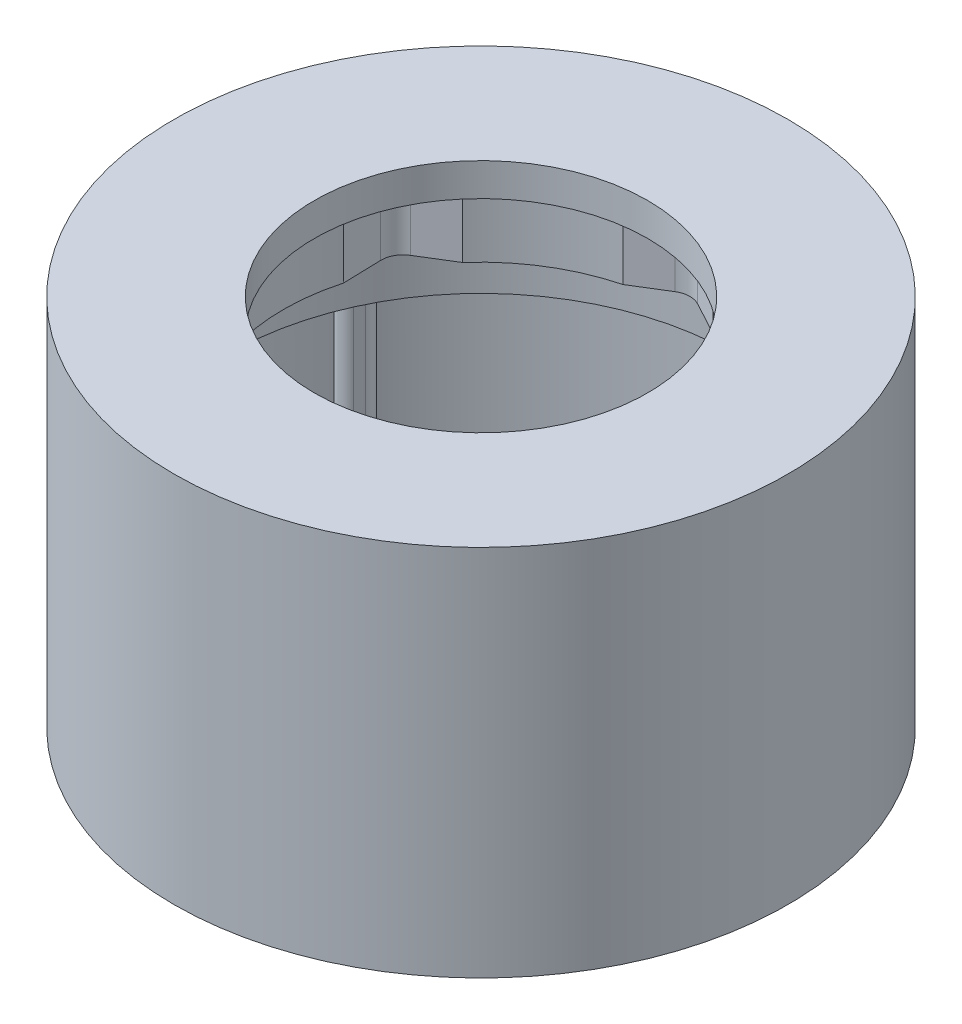
from build123d import *
from OCP.BRepFilletAPI import BRepFilletAPI_MakeChamfer

# Parameters (mm, degrees)
CUT_EXTRUDE_1_DEPTH  = 15.5
SKETCH_4_R           = 11.5
CUT_EXTRUDE_9_DEPTH  = 12
CUT_EXTRUDE_10_DEPTH = 9
FILLET_1_R           = 1
FILLET_2_R           = 0.5
CHAMFER_1_SIZE       = 1.538841769
CHAMFER_1_SIZE_2     = 0.5


with BuildPart() as part:
    # Эскиз1 → Повернуть1 (revolve)
    with BuildSketch(Plane.XY, mode=Mode.PRIVATE) as revolve_1_sk:
        Polygon((7.6, 118.642857143), (14, 118.642857143), (14, 101.642857143), (9, 101.642857143), (9, 117.142857143), (7.6, 117.142857143), align=None)
    revolve(revolve_1_sk.sketch.rotate(Axis((0, 0, 0), (0, 1, 0)), 90), axis=Axis((0, 0, 0), (0, 1, 0)))

    # Эскиз2 → Вырез-Вытянуть1 (cut)
    with BuildSketch(Plane.XZ.offset(-101.642857143)):
        Polygon((0.281764878, 9.926426441), (-8.455655027, 5.207228763), (-8.737419906, -4.719197678), (-0.281764878, -9.926426441), (8.455655027, -5.207228763), (8.737419906, 4.719197678), align=None)
    extrude(amount=-CUT_EXTRUDE_1_DEPTH, mode=Mode.SUBTRACT)

    # Эскиз4 → Вырез-Вытянуть9 (cut)
    with BuildSketch(Plane.XZ.offset(-101.642857143)):
        with Locations(Location((0, 0, 0), (0, 0, 270))):
            Circle(SKETCH_4_R)
    extrude(amount=-CUT_EXTRUDE_9_DEPTH, mode=Mode.SUBTRACT)

    # Эскиз5 → Вырез-Вытянуть10 (cut)
    with BuildSketch(Plane.XZ.offset(-101.642857143)):
        with BuildLine():
            Line((0, 12.6), (0, 13.1))
            ThreePointArc((0, 13.1), (-5.924928182, 11.683545097), (-10.568574903, 7.740492524))
            Line((-10.568574903, 7.740492524), (-10.165194182, 7.445053878))
            ThreePointArc((-10.165194182, 7.445053878), (-10.554097478, 6.882661289), (-10.911920088, 6.3))
            Line((-10.911920088, 6.3), (-11.34493279, 6.55))
            ThreePointArc((-11.34493279, 6.55), (-13.080710951, 0.710634227), (-11.987750615, -5.282408086))
            Line((-11.987750615, -5.282408086), (-11.530202882, -5.080789457))
            ThreePointArc((-11.530202882, -5.080789457), (-11.237608261, -5.698785885), (-10.911920088, -6.3))
            Line((-10.911920088, -6.3), (-11.34493279, -6.55))
            ThreePointArc((-11.34493279, -6.55), (-7.155782769, -10.97291087), (-1.419175712, -13.02290061))
            Line((-1.419175712, -13.02290061), (-1.3650087, -12.525843335))
            ThreePointArc((-1.3650087, -12.525843335), (-0.683510783, -12.581447175), (0, -12.6))
            Line((0, -12.6), (0, -13.1))
            ThreePointArc((0, -13.1), (5.924928182, -11.683545097), (10.568574903, -7.740492524))
            Line((10.568574903, -7.740492524), (10.165194182, -7.445053878))
            ThreePointArc((10.165194182, -7.445053878), (10.554097478, -6.882661289), (10.911920088, -6.3))
            Line((10.911920088, -6.3), (11.34493279, -6.55))
            ThreePointArc((11.34493279, -6.55), (13.080710951, -0.710634227), (11.987750615, 5.282408086))
            Line((11.987750615, 5.282408086), (11.530202882, 5.080789457))
            ThreePointArc((11.530202882, 5.080789457), (11.237608261, 5.698785885), (10.911920088, 6.3))
            Line((10.911920088, 6.3), (11.34493279, 6.55))
            ThreePointArc((11.34493279, 6.55), (7.155782769, 10.97291087), (1.419175712, 13.02290061))
            Line((1.419175712, 13.02290061), (1.3650087, 12.525843335))
            ThreePointArc((1.3650087, 12.525843335), (0.683510783, 12.581447175), (0, 12.6))
        make_face()
    extrude(amount=-CUT_EXTRUDE_10_DEPTH, mode=Mode.SUBTRACT)

    # Скругление1
    fillet_1_edges = [part.edges().sort_by_distance(p)[0] for p in [
        (-8.455655027, 115.392857143, 5.207228763),
        (0.281764878, 115.392857143, 9.926426441),
        (8.737419906, 115.392857143, 4.719197678),
        (8.455655027, 115.392857143, -5.207228763),
        (-0.281764878, 115.392857143, -9.926426441),
        (-8.737419906, 115.392857143, -4.719197678),
    ]]
    fillet(fillet_1_edges, radius=FILLET_1_R)

    # Скругление2
    fillet_2_edges = [part.edges().sort_by_distance(p)[0] for p in [
        (0, 106.142857143, 12.6),
        (1.3650087, 106.142857143, 12.525843335),
        (10.911920088, 106.142857143, 6.3),
        (11.530202882, 106.142857143, 5.080789457),
        (10.911920088, 106.142857143, -6.3),
        (10.165194182, 106.142857143, -7.445053878),
        (0, 106.142857143, -12.6),
        (-1.3650087, 106.142857143, -12.525843335),
        (-10.911920088, 106.142857143, -6.3),
        (-11.530202882, 106.142857143, -5.080789457),
        (-10.911920088, 106.142857143, 6.3),
        (-10.165194182, 106.142857143, 7.445053878),
    ]]
    fillet(fillet_2_edges, radius=FILLET_2_R)

    # Фаска1
    chamfer_1_edges_1 = [part.edges().sort_by_distance(p)[0] for p in [
        (-10.564724448, 101.642857143, 7.737672426),
    ]]
    chamfer_1_side_1 = [part.faces().sort_by_distance(p)[0] for p in [
        (-10.564724448, 101.652857143, 7.737672426),
    ]]
    chamfer_1_edges_2 = [part.edges().sort_by_distance(p)[0] for p in [
        (-11.983383111, 101.642857143, -5.280483543),
    ]]
    chamfer_1_side_2 = [part.faces().sort_by_distance(p)[0] for p in [
        (-11.983383111, 101.652857143, -5.280483543),
    ]]
    chamfer_1_edges_3 = [part.edges().sort_by_distance(p)[0] for p in [
        (-1.418658663, 101.642857143, -13.018155968),
    ]]
    chamfer_1_side_3 = [part.faces().sort_by_distance(p)[0] for p in [
        (-1.418658663, 101.652857143, -13.018155968),
    ]]
    chamfer_1_edges_4 = [part.edges().sort_by_distance(p)[0] for p in [
        (10.564724448, 101.642857143, -7.737672426),
    ]]
    chamfer_1_side_4 = [part.faces().sort_by_distance(p)[0] for p in [
        (10.564724448, 101.652857143, -7.737672426),
    ]]
    chamfer_1_edges_5 = [part.edges().sort_by_distance(p)[0] for p in [
        (11.983383111, 101.642857143, 5.280483543),
    ]]
    chamfer_1_side_5 = [part.faces().sort_by_distance(p)[0] for p in [
        (11.983383111, 101.652857143, 5.280483543),
    ]]
    chamfer_1_edges_6 = [part.edges().sort_by_distance(p)[0] for p in [
        (1.418658663, 101.642857143, 13.018155968),
    ]]
    chamfer_1_side_6 = [part.faces().sort_by_distance(p)[0] for p in [
        (1.418658663, 101.652857143, 13.018155968),
    ]]
    chamfer_1_edges_7 = [part.edges().sort_by_distance(p)[0] for p in [
        (10.554097478, 101.642857143, -6.882661289),
    ]]
    chamfer_1_side_7 = [part.faces().sort_by_distance(p)[0] for p in [
        (10.554097478, 101.652857143, -6.882661289),
    ]]
    chamfer_1_edges_8 = [part.edges().sort_by_distance(p)[0] for p in [
        (0.683510783, 101.642857143, 12.581447175),
    ]]
    chamfer_1_side_8 = [part.faces().sort_by_distance(p)[0] for p in [
        (0.683510783, 101.652857143, 12.581447175),
    ]]
    chamfer_1_edges_9 = [part.edges().sort_by_distance(p)[0] for p in [
        (11.340799483, 101.642857143, 6.547613634),
    ]]
    chamfer_1_side_9 = [part.faces().sort_by_distance(p)[0] for p in [
        (11.340799483, 101.652857143, 6.547613634),
    ]]
    chamfer_1_edges_10 = [part.edges().sort_by_distance(p)[0] for p in [
        (11.237608261, 101.642857143, 5.698785885),
    ]]
    chamfer_1_side_10 = [part.faces().sort_by_distance(p)[0] for p in [
        (11.237608261, 101.652857143, 5.698785885),
    ]]
    chamfer_1_edges_11 = [part.edges().sort_by_distance(p)[0] for p in [
        (11.340799483, 101.642857143, -6.547613634),
    ]]
    chamfer_1_side_11 = [part.faces().sort_by_distance(p)[0] for p in [
        (11.340799483, 101.652857143, -6.547613634),
    ]]
    chamfer_1_edges_12 = [part.edges().sort_by_distance(p)[0] for p in [
        (0, 101.642857143, -13.095227269),
    ]]
    chamfer_1_side_12 = [part.faces().sort_by_distance(p)[0] for p in [
        (0, 101.652857143, -13.095227269),
    ]]
    chamfer_1_edges_13 = [part.edges().sort_by_distance(p)[0] for p in [
        (-0.683510783, 101.642857143, -12.581447175),
    ]]
    chamfer_1_side_13 = [part.faces().sort_by_distance(p)[0] for p in [
        (-0.683510783, 101.652857143, -12.581447175),
    ]]
    chamfer_1_edges_14 = [part.edges().sort_by_distance(p)[0] for p in [
        (-11.340799483, 101.642857143, -6.547613634),
    ]]
    chamfer_1_side_14 = [part.faces().sort_by_distance(p)[0] for p in [
        (-11.340799483, 101.652857143, -6.547613634),
    ]]
    chamfer_1_edges_15 = [part.edges().sort_by_distance(p)[0] for p in [
        (-11.237608261, 101.642857143, -5.698785885),
    ]]
    chamfer_1_side_15 = [part.faces().sort_by_distance(p)[0] for p in [
        (-11.237608261, 101.652857143, -5.698785885),
    ]]
    chamfer_1_edges_16 = [part.edges().sort_by_distance(p)[0] for p in [
        (-11.340799483, 101.642857143, 6.547613634),
    ]]
    chamfer_1_side_16 = [part.faces().sort_by_distance(p)[0] for p in [
        (-11.340799483, 101.652857143, 6.547613634),
    ]]
    chamfer_1_edges_17 = [part.edges().sort_by_distance(p)[0] for p in [
        (-10.554097478, 101.642857143, 6.882661289),
    ]]
    chamfer_1_side_17 = [part.faces().sort_by_distance(p)[0] for p in [
        (-10.554097478, 101.652857143, 6.882661289),
    ]]
    chamfer_1_edges_18 = [part.edges().sort_by_distance(p)[0] for p in [
        (0, 101.642857143, 13.095227269),
    ]]
    chamfer_1_side_18 = [part.faces().sort_by_distance(p)[0] for p in [
        (0, 101.652857143, 13.095227269),
    ]]
    chamfer_1_edges_19 = [part.edges().sort_by_distance(p)[0] for p in [
        (0.139762589, 101.642857143, 12.74371399),
    ]]
    chamfer_1_side_19 = [part.faces().sort_by_distance(p)[0] for p in [
        (0.139762589, 101.652857143, 12.74371399),
    ]]
    chamfer_1_edges_20 = [part.edges().sort_by_distance(p)[0] for p in [
        (1.241637792, 101.642857143, 12.683852547),
    ]]
    chamfer_1_side_20 = [part.faces().sort_by_distance(p)[0] for p in [
        (1.241637792, 101.652857143, 12.683852547),
    ]]
    chamfer_1_edges_21 = [part.edges().sort_by_distance(p)[0] for p in [
        (11.106261348, 101.642857143, 6.250819042),
    ]]
    chamfer_1_side_21 = [part.faces().sort_by_distance(p)[0] for p in [
        (11.106261348, 101.652857143, 6.250819042),
    ]]
    chamfer_1_edges_22 = [part.edges().sort_by_distance(p)[0] for p in [
        (11.605357419, 101.642857143, 5.266636403),
    ]]
    chamfer_1_side_22 = [part.faces().sort_by_distance(p)[0] for p in [
        (11.605357419, 101.652857143, 5.266636403),
    ]]
    chamfer_1_edges_23 = [part.edges().sort_by_distance(p)[0] for p in [
        (-10.966498759, 101.642857143, 6.492894947),
    ]]
    chamfer_1_side_23 = [part.faces().sort_by_distance(p)[0] for p in [
        (-10.966498759, 101.652857143, 6.492894947),
    ]]
    chamfer_1_edges_24 = [part.edges().sort_by_distance(p)[0] for p in [
        (-10.363719627, 101.642857143, 7.417216143),
    ]]
    chamfer_1_side_24 = [part.faces().sort_by_distance(p)[0] for p in [
        (-10.363719627, 101.652857143, 7.417216143),
    ]]
    chamfer_1_edges_25 = [part.edges().sort_by_distance(p)[0] for p in [
        (-11.605357419, 101.642857143, -5.266636403),
    ]]
    chamfer_1_side_25 = [part.faces().sort_by_distance(p)[0] for p in [
        (-11.605357419, 101.652857143, -5.266636403),
    ]]
    chamfer_1_edges_26 = [part.edges().sort_by_distance(p)[0] for p in [
        (-11.106261348, 101.642857143, -6.250819042),
    ]]
    chamfer_1_side_26 = [part.faces().sort_by_distance(p)[0] for p in [
        (-11.106261348, 101.652857143, -6.250819042),
    ]]
    chamfer_1_edges_27 = [part.edges().sort_by_distance(p)[0] for p in [
        (-0.139762589, 101.642857143, -12.74371399),
    ]]
    chamfer_1_side_27 = [part.faces().sort_by_distance(p)[0] for p in [
        (-0.139762589, 101.652857143, -12.74371399),
    ]]
    chamfer_1_edges_28 = [part.edges().sort_by_distance(p)[0] for p in [
        (-1.241637792, 101.642857143, -12.683852547),
    ]]
    chamfer_1_side_28 = [part.faces().sort_by_distance(p)[0] for p in [
        (-1.241637792, 101.652857143, -12.683852547),
    ]]
    chamfer_1_edges_29 = [part.edges().sort_by_distance(p)[0] for p in [
        (10.966498759, 101.642857143, -6.492894947),
    ]]
    chamfer_1_side_29 = [part.faces().sort_by_distance(p)[0] for p in [
        (10.966498759, 101.652857143, -6.492894947),
    ]]
    chamfer_1_edges_30 = [part.edges().sort_by_distance(p)[0] for p in [
        (10.363719627, 101.642857143, -7.417216143),
    ]]
    chamfer_1_side_30 = [part.faces().sort_by_distance(p)[0] for p in [
        (10.363719627, 101.652857143, -7.417216143),
    ]]
    chamfer_1 = BRepFilletAPI_MakeChamfer(part.part.solid().wrapped)
    for e in chamfer_1_edges_1:
        chamfer_1.Add(CHAMFER_1_SIZE - 0.0001, CHAMFER_1_SIZE_2 - 0.0001, e.wrapped, chamfer_1_side_1[0].wrapped)
    for e in chamfer_1_edges_2:
        chamfer_1.Add(CHAMFER_1_SIZE - 0.0001, CHAMFER_1_SIZE_2 - 0.0001, e.wrapped, chamfer_1_side_2[0].wrapped)
    for e in chamfer_1_edges_3:
        chamfer_1.Add(CHAMFER_1_SIZE - 0.0001, CHAMFER_1_SIZE_2 - 0.0001, e.wrapped, chamfer_1_side_3[0].wrapped)
    for e in chamfer_1_edges_4:
        chamfer_1.Add(CHAMFER_1_SIZE - 0.0001, CHAMFER_1_SIZE_2 - 0.0001, e.wrapped, chamfer_1_side_4[0].wrapped)
    for e in chamfer_1_edges_5:
        chamfer_1.Add(CHAMFER_1_SIZE - 0.0001, CHAMFER_1_SIZE_2 - 0.0001, e.wrapped, chamfer_1_side_5[0].wrapped)
    for e in chamfer_1_edges_6:
        chamfer_1.Add(CHAMFER_1_SIZE - 0.0001, CHAMFER_1_SIZE_2 - 0.0001, e.wrapped, chamfer_1_side_6[0].wrapped)
    for e in chamfer_1_edges_7:
        chamfer_1.Add(CHAMFER_1_SIZE - 0.0001, CHAMFER_1_SIZE_2 - 0.0001, e.wrapped, chamfer_1_side_7[0].wrapped)
    for e in chamfer_1_edges_8:
        chamfer_1.Add(CHAMFER_1_SIZE - 0.0001, CHAMFER_1_SIZE_2 - 0.0001, e.wrapped, chamfer_1_side_8[0].wrapped)
    for e in chamfer_1_edges_9:
        chamfer_1.Add(CHAMFER_1_SIZE - 0.0001, CHAMFER_1_SIZE_2 - 0.0001, e.wrapped, chamfer_1_side_9[0].wrapped)
    for e in chamfer_1_edges_10:
        chamfer_1.Add(CHAMFER_1_SIZE - 0.0001, CHAMFER_1_SIZE_2 - 0.0001, e.wrapped, chamfer_1_side_10[0].wrapped)
    for e in chamfer_1_edges_11:
        chamfer_1.Add(CHAMFER_1_SIZE - 0.0001, CHAMFER_1_SIZE_2 - 0.0001, e.wrapped, chamfer_1_side_11[0].wrapped)
    for e in chamfer_1_edges_12:
        chamfer_1.Add(CHAMFER_1_SIZE - 0.0001, CHAMFER_1_SIZE_2 - 0.0001, e.wrapped, chamfer_1_side_12[0].wrapped)
    for e in chamfer_1_edges_13:
        chamfer_1.Add(CHAMFER_1_SIZE - 0.0001, CHAMFER_1_SIZE_2 - 0.0001, e.wrapped, chamfer_1_side_13[0].wrapped)
    for e in chamfer_1_edges_14:
        chamfer_1.Add(CHAMFER_1_SIZE - 0.0001, CHAMFER_1_SIZE_2 - 0.0001, e.wrapped, chamfer_1_side_14[0].wrapped)
    for e in chamfer_1_edges_15:
        chamfer_1.Add(CHAMFER_1_SIZE - 0.0001, CHAMFER_1_SIZE_2 - 0.0001, e.wrapped, chamfer_1_side_15[0].wrapped)
    for e in chamfer_1_edges_16:
        chamfer_1.Add(CHAMFER_1_SIZE - 0.0001, CHAMFER_1_SIZE_2 - 0.0001, e.wrapped, chamfer_1_side_16[0].wrapped)
    for e in chamfer_1_edges_17:
        chamfer_1.Add(CHAMFER_1_SIZE - 0.0001, CHAMFER_1_SIZE_2 - 0.0001, e.wrapped, chamfer_1_side_17[0].wrapped)
    for e in chamfer_1_edges_18:
        chamfer_1.Add(CHAMFER_1_SIZE - 0.0001, CHAMFER_1_SIZE_2 - 0.0001, e.wrapped, chamfer_1_side_18[0].wrapped)
    for e in chamfer_1_edges_19:
        chamfer_1.Add(CHAMFER_1_SIZE - 0.0001, CHAMFER_1_SIZE_2 - 0.0001, e.wrapped, chamfer_1_side_19[0].wrapped)
    for e in chamfer_1_edges_20:
        chamfer_1.Add(CHAMFER_1_SIZE - 0.0001, CHAMFER_1_SIZE_2 - 0.0001, e.wrapped, chamfer_1_side_20[0].wrapped)
    for e in chamfer_1_edges_21:
        chamfer_1.Add(CHAMFER_1_SIZE - 0.0001, CHAMFER_1_SIZE_2 - 0.0001, e.wrapped, chamfer_1_side_21[0].wrapped)
    for e in chamfer_1_edges_22:
        chamfer_1.Add(CHAMFER_1_SIZE - 0.0001, CHAMFER_1_SIZE_2 - 0.0001, e.wrapped, chamfer_1_side_22[0].wrapped)
    for e in chamfer_1_edges_23:
        chamfer_1.Add(CHAMFER_1_SIZE - 0.0001, CHAMFER_1_SIZE_2 - 0.0001, e.wrapped, chamfer_1_side_23[0].wrapped)
    for e in chamfer_1_edges_24:
        chamfer_1.Add(CHAMFER_1_SIZE - 0.0001, CHAMFER_1_SIZE_2 - 0.0001, e.wrapped, chamfer_1_side_24[0].wrapped)
    for e in chamfer_1_edges_25:
        chamfer_1.Add(CHAMFER_1_SIZE - 0.0001, CHAMFER_1_SIZE_2 - 0.0001, e.wrapped, chamfer_1_side_25[0].wrapped)
    for e in chamfer_1_edges_26:
        chamfer_1.Add(CHAMFER_1_SIZE - 0.0001, CHAMFER_1_SIZE_2 - 0.0001, e.wrapped, chamfer_1_side_26[0].wrapped)
    for e in chamfer_1_edges_27:
        chamfer_1.Add(CHAMFER_1_SIZE - 0.0001, CHAMFER_1_SIZE_2 - 0.0001, e.wrapped, chamfer_1_side_27[0].wrapped)
    for e in chamfer_1_edges_28:
        chamfer_1.Add(CHAMFER_1_SIZE - 0.0001, CHAMFER_1_SIZE_2 - 0.0001, e.wrapped, chamfer_1_side_28[0].wrapped)
    for e in chamfer_1_edges_29:
        chamfer_1.Add(CHAMFER_1_SIZE - 0.0001, CHAMFER_1_SIZE_2 - 0.0001, e.wrapped, chamfer_1_side_29[0].wrapped)
    for e in chamfer_1_edges_30:
        chamfer_1.Add(CHAMFER_1_SIZE - 0.0001, CHAMFER_1_SIZE_2 - 0.0001, e.wrapped, chamfer_1_side_30[0].wrapped)
    add(Compound.cast(chamfer_1.Shape()), mode=Mode.REPLACE)  # a hair under: the kernel refuses the full size


solid = part.part
